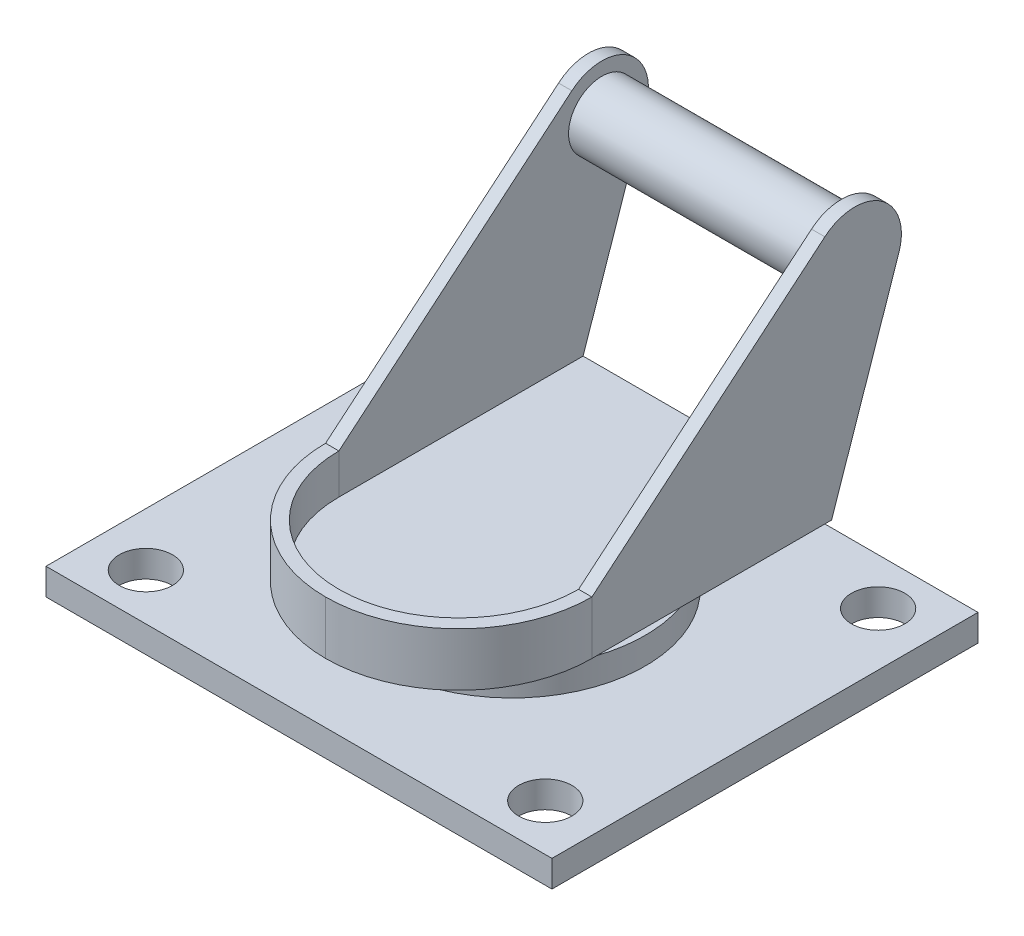
from build123d import *

# Parameters (mm, degrees)
SKETCH1_W               = 38
SKETCH1_H               = 32
SKETCH1_R               = 2
BOSS_EXTRUDE1_DEPTH     = 2
SKETCH2_R               = 10
SKETCH2_R_2             = 9
BOSS_EXTRUDE2_DEPTH     = 2
BOSS_EXTRUDE3_DEPTH     = 10
FILLET1_R               = 10
SHELL1_START            = 5.5
SHELL1_DEPTH            = 18.5
SKETCH5_R               = 8
BOSS_EXTRUDE4_DEPTH     = 2.5
BOSS_EXTRUDE5_START     = -19
BOSS_EXTRUDE5_OUTLINE_R = 2.5
BOSS_EXTRUDE5_DEPTH     = 18


# Read off the part's stored shape, not the designer's step: Shell1, Boss-Extrude5
with BuildPart() as part:
    # Sketch1 → Boss-Extrude1 (new body)
    with BuildSketch(Plane(origin=(0, 0, 0), x_dir=(1, 0, 0), z_dir=(0, 1, 0))):
        Rectangle(SKETCH1_W, SKETCH1_H)
        with Locations(Location((-15, 12.5, 0), (0, 0, 270))):
            Circle(SKETCH1_R, mode=Mode.SUBTRACT)
        with Locations(Location((15, 12.5, 0), (0, 0, 90))):
            Circle(SKETCH1_R, mode=Mode.SUBTRACT)
        with Locations(Location((-15, -12.5, 0), (0, 0, 90))):
            Circle(SKETCH1_R, mode=Mode.SUBTRACT)
        with Locations(Location((15, -12.5, 0), (0, 0, 270))):
            Circle(SKETCH1_R, mode=Mode.SUBTRACT)
    extrude(amount=BOSS_EXTRUDE1_DEPTH)

    # Sketch2 → Boss-Extrude2 (add)
    with BuildSketch(Plane(origin=(0, 2, 0), x_dir=(1, 0, 0), z_dir=(0, 1, 0))):
        with Locations(Location((0, 0, 0), (0, 0, 90))):
            Circle(SKETCH2_R)
        with Locations(Location((0, 0, 0), (0, 0, 270))):
            Circle(SKETCH2_R_2, mode=Mode.SUBTRACT)
    extrude(amount=BOSS_EXTRUDE2_DEPTH)


with BuildPart() as body_2:
    # Sketch4 → Boss-Extrude3 (new, symmetric)
    with BuildSketch(Plane(origin=(0, 0, 0), x_dir=(0, 0, -1), z_dir=(1, 0, 0))):
        with BuildLine():
            Line((-14, 4.5), (14, 4.5))
            Line((14, 4.5), (19.059587868, 19.372772229))
            ThreePointArc((19.059587868, 19.372772229), (17.72315501, 23.388106748), (13.496319871, 23.181155551))
            Line((13.496319871, 23.181155551), (-4, 8.5))
            Line((-4, 8.5), (-14, 8.5))
            Line((-14, 8.5), (-14, 4.5))
        make_face()
    extrude(amount=BOSS_EXTRUDE3_DEPTH, both=True)

    # Fillet1
    fillet1_edges = [body_2.edges().sort_by_distance(p)[0] for p in [
        (10, 6.5, 14),
        (-10, 6.5, 14),
    ]]
    fillet(fillet1_edges, radius=FILLET1_R - 0.0001)  # a hair under: the kernel refuses the full size

    # Shell1 outline → Shell1 (cut)
    with BuildSketch(Plane(origin=(0, 0, 0), x_dir=(1, 0, 0), z_dir=(0, 1, 0)).offset(SHELL1_START)):
        with BuildLine():
            ThreePointArc((0, -13), (6.363961031, -10.363961031), (9, -4))
            Line((9, -4), (9, 21))
            Line((9, 21), (-9, 21))
            Line((-9, 21), (-9, -4))
            ThreePointArc((-9, -4), (-6.363961031, -10.363961031), (0, -13))
        make_face()
    extrude(amount=SHELL1_DEPTH, mode=Mode.SUBTRACT)

    # Sketch5 → Boss-Extrude4 (add)
    with BuildSketch(Plane.XZ.offset(-4.5)):
        with Locations(Location((0, 0, 0), (0, 0, 270))):
            Circle(SKETCH5_R)
    extrude(amount=BOSS_EXTRUDE4_DEPTH)

    # Boss-Extrude5 outline → Boss-Extrude5 (add)
    with BuildSketch(Plane.ZY.offset(10).offset(BOSS_EXTRUDE5_START)):
        with Locations((-15.746076505, 20.5)):
            Circle(BOSS_EXTRUDE5_OUTLINE_R)
    extrude(amount=BOSS_EXTRUDE5_DEPTH)


solid = Compound([part.part, body_2.part])
